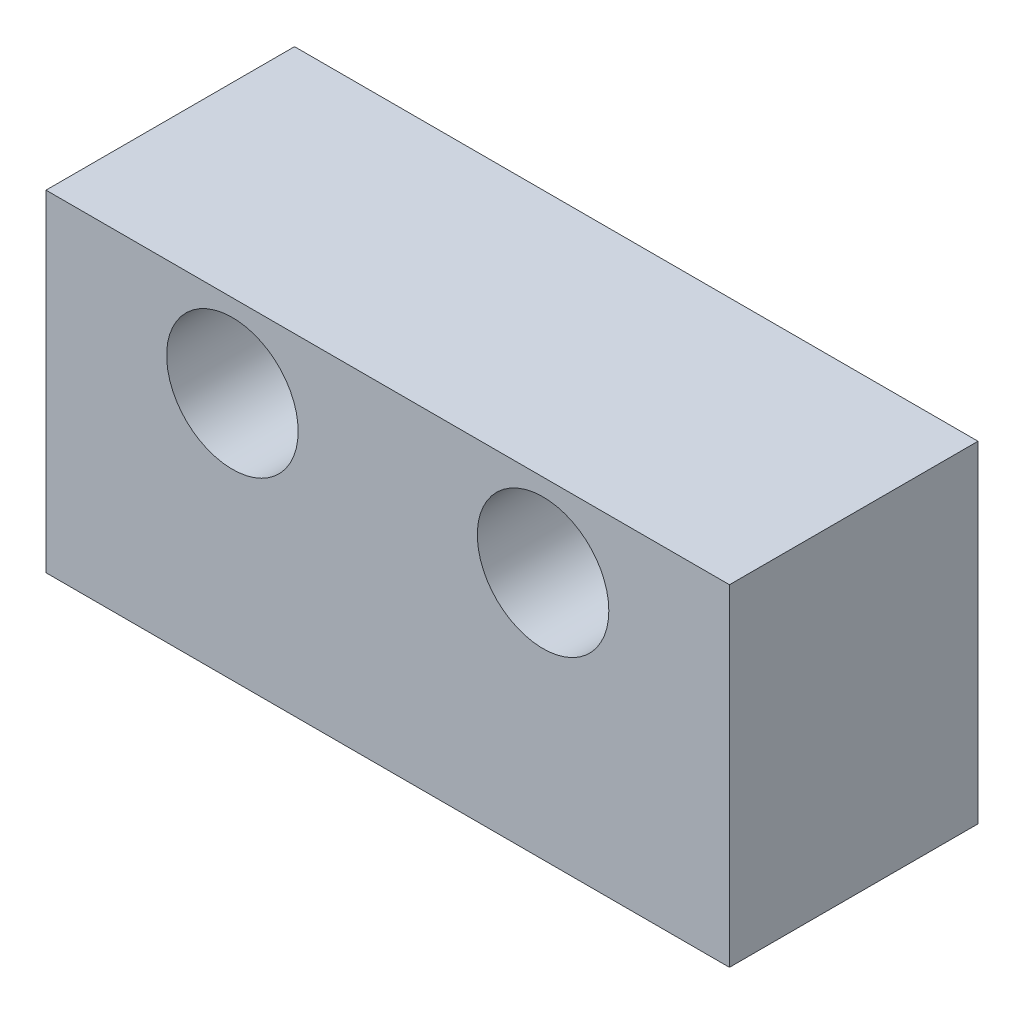
from build123d import *

# Parameters (mm, degrees)
SKETCH1_W           = 33
SKETCH1_H           = 16
SKETCH1_R           = 3.175
BOSS_EXTRUDE1_DEPTH = 12


with BuildPart() as part:
    # Sketch1 → Boss-Extrude1 (new body)
    with BuildSketch(Plane.XY):
        with Locations((0, -4)):
            Rectangle(SKETCH1_W, SKETCH1_H)
        with Locations((7.5, 0)):
            Circle(SKETCH1_R, mode=Mode.SUBTRACT)
        with Locations((-7.5, 0)):
            Circle(SKETCH1_R, mode=Mode.SUBTRACT)
    extrude(amount=BOSS_EXTRUDE1_DEPTH)


solid = part.part
